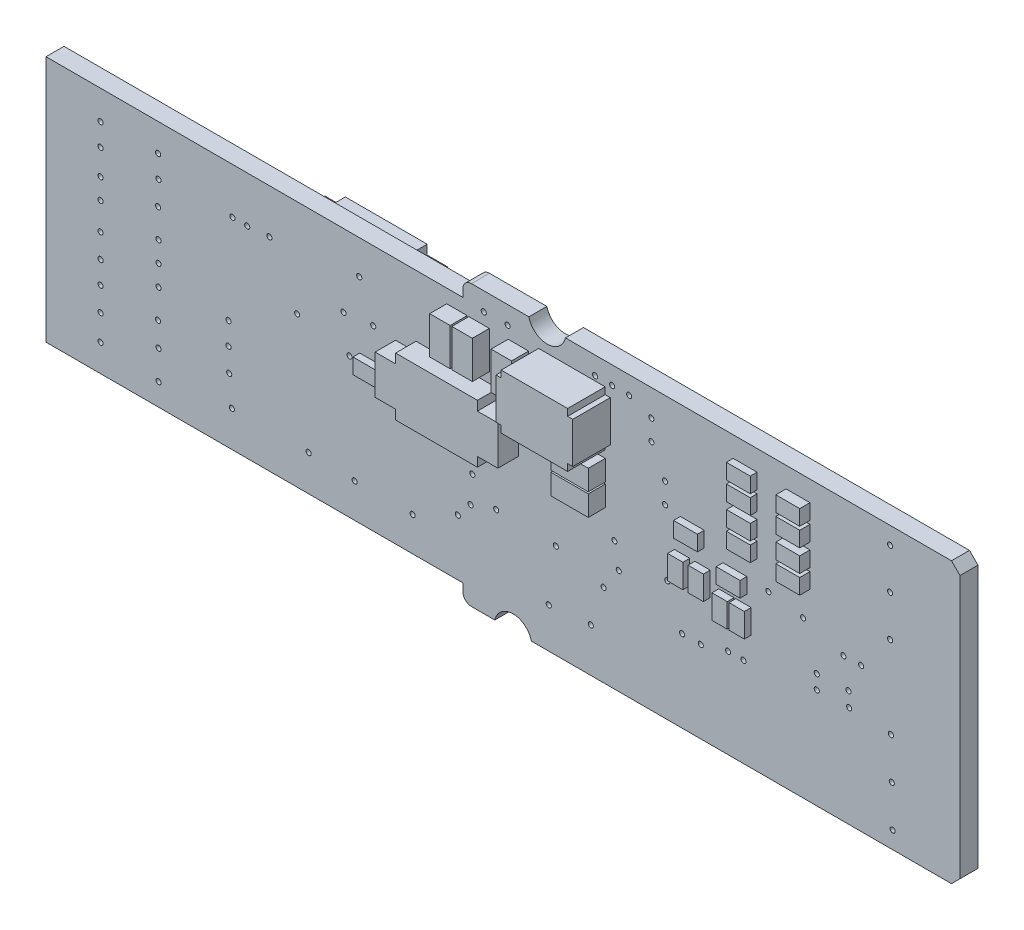
from build123d import *

# Parameters (mm, degrees)
BOARD_DEPTH         = 1.055
SKETCH2_R           = 0.15
PLATED_HOLES_DEPTH  = 56.792253271
SKETCH5_W           = 8.85
SKETCH5_H           = 4.1
R0203NAS_CE_1_DEPTH = 0.7
SKETCH6_W           = 8.85
SKETCH6_H           = 4.1
R0203NAS_CE_2_DEPTH = 0.7
SKETCH7_W           = 8.85
SKETCH7_H           = 4.1
R0203NAS_CE_3_DEPTH = 0.7
SKETCH8_W           = 1.4
SKETCH8_H           = 0.9
R0201NAS_1_DEPTH    = 0.4
SKETCH9_W           = 1.4
SKETCH9_H           = 0.9
R0201NAS_2_DEPTH    = 0.4
SKETCH10_W          = 1.4
SKETCH10_H          = 0.9
R0201NAS_3_DEPTH    = 0.4
SKETCH11_W          = 1.4
SKETCH11_H          = 0.9
R0201NAS_4_DEPTH    = 0.4
SKETCH12_W          = 1.4
SKETCH12_H          = 0.9
R0201NAS_5_DEPTH    = 0.4
SKETCH13_W          = 1.4
SKETCH13_H          = 0.9
R0201NAS_6_DEPTH    = 0.4
SKETCH14_W          = 1.4
SKETCH14_H          = 0.9
R0201NAS_7_DEPTH    = 0.4
SKETCH15_W          = 1.4
SKETCH15_H          = 0.9
R0201NAS_8_DEPTH    = 0.4
SKETCH16_W          = 1.4
SKETCH16_H          = 0.9
R0201NAS_9_DEPTH    = 0.4
SKETCH17_W          = 1.4
SKETCH17_H          = 0.9
R0201NAS_10_DEPTH   = 0.4
SKETCH18_W          = 1.4
SKETCH18_H          = 0.9
R0201NAS_11_DEPTH   = 0.4
SKETCH19_W          = 1.4
SKETCH19_H          = 0.9
R0201NAS_12_DEPTH   = 0.4
SKETCH20_W          = 0.9
SKETCH20_H          = 1.4
R0201NAS_13_DEPTH   = 0.4
SKETCH21_W          = 1.4
SKETCH21_H          = 0.9
R0201NAS_14_DEPTH   = 0.4
SKETCH22_W          = 1.4
SKETCH22_H          = 0.9
R0201NAS_15_DEPTH   = 0.4
SKETCH23_W          = 1.4
SKETCH23_H          = 0.9
R0201NAS_16_DEPTH   = 0.4
SKETCH24_W          = 1.4
SKETCH24_H          = 0.9
R0201NAS_17_DEPTH   = 0.4
SKETCH25_W          = 1.4
SKETCH25_H          = 0.9
R0201NAS_18_DEPTH   = 0.4
SKETCH26_W          = 1.4
SKETCH26_H          = 0.9
R0201NAS_19_DEPTH   = 0.4
SKETCH27_W          = 0.9
SKETCH27_H          = 1.4
R0201NAS_20_DEPTH   = 0.4
SKETCH28_W          = 0.9
SKETCH28_H          = 1.4
R0201NAS_21_DEPTH   = 0.4
SKETCH29_W          = 1.4
SKETCH29_H          = 0.9
R0201NAS_22_DEPTH   = 0.4
SKETCH30_W          = 1.4
SKETCH30_H          = 0.9
R0201NAS_23_DEPTH   = 0.4
SKETCH31_W          = 1.4
SKETCH31_H          = 0.9
R0201NAS_24_DEPTH   = 0.4
SKETCH32_W          = 0.9
SKETCH32_H          = 1.4
R0201NAS_25_DEPTH   = 0.4
SKETCH33_W          = 1.4
SKETCH33_H          = 0.9
R0201NAS_26_DEPTH   = 0.4
SKETCH34_W          = 0.9
SKETCH34_H          = 1.4
R0201NAS_27_DEPTH   = 0.4
SKETCH35_W          = 1.4
SKETCH35_H          = 0.9
R0201NAS_28_DEPTH   = 0.4
SKETCH36_W          = 0.9
SKETCH36_H          = 1.4
R0201NAS_29_DEPTH   = 0.4
SKETCH37_W          = 1.4
SKETCH37_H          = 0.9
R0201NAS_30_DEPTH   = 0.4
SKETCH38_W          = 1.4
SKETCH38_H          = 0.9
R0201NAS_31_DEPTH   = 0.4
SKETCH39_W          = 1.4
SKETCH39_H          = 0.9
R0201NAS_32_DEPTH   = 0.4
SKETCH40_W          = 1.4
SKETCH40_H          = 0.9
R0201NAS_33_DEPTH   = 0.4
SKETCH41_W          = 1.4
SKETCH41_H          = 0.9
R0201NAS_34_DEPTH   = 0.4
SKETCH42_W          = 1.4
SKETCH42_H          = 0.9
R0201NAS_35_DEPTH   = 0.4
SKETCH43_W          = 1.4
SKETCH43_H          = 0.9
R0201NAS_36_DEPTH   = 0.4
SKETCH44_W          = 1.4
SKETCH44_H          = 0.9
R0201NAS_37_DEPTH   = 0.4
SKETCH45_W          = 0.9
SKETCH45_H          = 1.4
R0201NAS_38_DEPTH   = 0.4
CE211NAS_1_DEPTH    = 2.2
SKETCH47_W          = 2.2
SKETCH47_H          = 1.2
C0204NAS_1_DEPTH    = 1
SKETCH48_W          = 2.2
SKETCH48_H          = 1.2
C0204NAS_2_DEPTH    = 1
SKETCH49_W          = 1.2
SKETCH49_H          = 2.2
C0204NAS_3_DEPTH    = 1
SKETCH50_W          = 2.2
SKETCH50_H          = 1.2
C0204NAS_4_DEPTH    = 1
SKETCH51_W          = 2.2
SKETCH51_H          = 1.2
C0204NAS_5_DEPTH    = 1
SKETCH52_W          = 1.2
SKETCH52_H          = 2.2
C0204NAS_6_DEPTH    = 1
SKETCH53_W          = 1.2
SKETCH53_H          = 2.2
C0204NAS_7_DEPTH    = 1
SKETCH54_W          = 2.2
SKETCH54_H          = 1.2
C0204NAS_8_DEPTH    = 1
SKETCH55_W          = 1.4
SKETCH55_H          = 0.9
C0215NAS_1_DEPTH    = 0.6
SKETCH56_W          = 1.4
SKETCH56_H          = 0.9
C0215NAS_2_DEPTH    = 0.6
SKETCH57_W          = 1.4
SKETCH57_H          = 0.9
C0215NAS_3_DEPTH    = 0.6
SKETCH58_W          = 1.4
SKETCH58_H          = 0.9
C0215NAS_4_DEPTH    = 0.6
SKETCH59_W          = 1.4
SKETCH59_H          = 0.9
C0215NAS_5_DEPTH    = 0.6
SKETCH60_W          = 1.4
SKETCH60_H          = 0.9
C0215NAS_6_DEPTH    = 0.6
SKETCH61_W          = 1.4
SKETCH61_H          = 0.9
C0215NAS_7_DEPTH    = 0.6
SKETCH62_W          = 1.4
SKETCH62_H          = 0.9
C0215NAS_8_DEPTH    = 0.6
Z0562NAS_1_DEPTH    = 1.2
Z0898NAS_1_DEPTH    = 1.2
Z0898NAS_2_DEPTH    = 1.2
Z0G58NAS_1_DEPTH    = 1.2


with BuildPart() as part:
    # Sketch1 → BOARD (new body)
    with BuildSketch(Plane.XY):
        with BuildLine():
            Line((24.45, 14.95), (24.45, 14.5))
            Line((24.45, 14.5), (2.3285, 14.5))
            Line((2.3285, 14.5), (0.2516, 14.5))
            Line((0.2516, 14.5), (0, 14.5))
            Line((0, 14.5), (0, 13.75))
            Line((0, 13.75), (0, 0.75))
            Line((0, 0.75), (0, 0))
            Line((0, 0), (0.2516, 0))
            Line((0.2516, 0), (2.3285, 0))
            Line((2.3285, 0), (24.45, 0))
            Line((24.45, 0), (24.45, -0.45))
            ThreePointArc((24.45, -0.45), (24.596455555, -0.803544445), (24.95, -0.95))
            Line((24.95, -0.95), (26.1285, -0.95))
            Line((26.1285, -0.95), (26.3188, -0.95))
            ThreePointArc((26.3188, -0.95), (27.39005, -0.099902191), (28.4613, -0.95))
            Line((28.4613, -0.95), (45.34, -0.95))
            Line((45.34, -0.95), (47.34, -0.95))
            Line((47.34, -0.95), (53.1, -0.95))
            Line((53.1, -0.95), (53.6, -0.45))
            Line((53.6, -0.45), (53.6, 14.95))
            Line((53.6, 14.95), (53.1, 15.45))
            Line((53.1, 15.45), (47.34, 15.45))
            Line((47.34, 15.45), (45.34, 15.45))
            Line((45.34, 15.45), (30.4613, 15.45))
            ThreePointArc((30.4613, 15.45), (29.39005, 14.599947896), (28.3188, 15.45))
            Line((28.3188, 15.45), (27.1285, 15.45))
            Line((27.1285, 15.45), (25.2516, 15.45))
            Line((25.2516, 15.45), (24.95, 15.45))
            ThreePointArc((24.95, 15.45), (24.596445331, 15.303554669), (24.45, 14.95))
        make_face()
    extrude(amount=BOARD_DEPTH)

    # Sketch2 → PLATED HOLES (cut, through all)
    with BuildSketch(Plane.XY):
        with Locations((38.4, 3.85)):
            Circle(SKETCH2_R)
        with Locations((37.3, 3.85)):
            Circle(SKETCH2_R)
        with Locations((10.7, 6.45)):
            Circle(SKETCH2_R)
        with Locations((10.9, 2.09)):
            Circle(SKETCH2_R)
        with Locations((10.7437, 3.79)):
            Circle(SKETCH2_R)
        with Locations((31.95, 1.62)):
            Circle(SKETCH2_R)
        with Locations((15.4, 2.1)):
            Circle(SKETCH2_R)
        with Locations((26.4, 4.7)):
            Circle(SKETCH2_R)
        with Locations((25, 7.25)):
            Circle(SKETCH2_R)
        with Locations((24.9, 4.2)):
            Circle(SKETCH2_R)
        with Locations((28.5234, 10.9401)):
            Circle(SKETCH2_R)
        with Locations((27.6985, 11.0002)):
            Circle(SKETCH2_R)
        with Locations((32.7, 3.9)):
            Circle(SKETCH2_R)
        with Locations((21.5, 2)):
            Circle(SKETCH2_R)
        with Locations((17.446, 10.2478)):
            Circle(SKETCH2_R)
        with Locations((13.1, 11.9)):
            Circle(SKETCH2_R)
        with Locations((24.33, 8.18)):
            Circle(SKETCH2_R)
        with Locations((24.15, 3.3)):
            Circle(SKETCH2_R)
        with Locations((6.573, 12.87)):
            Circle(SKETCH2_R)
        with Locations((47.8, 7.4841)):
            Circle(SKETCH2_R)
        with Locations((46.76, 7.46)):
            Circle(SKETCH2_R)
        with Locations((30.8, 7.6)):
            Circle(SKETCH2_R)
        with Locations((29.8, 7.6)):
            Circle(SKETCH2_R)
        with Locations((6.6, 11.57)):
            Circle(SKETCH2_R)
        with Locations((6.573, 10.17)):
            Circle(SKETCH2_R)
        with Locations((47.06, 5.83)):
            Circle(SKETCH2_R)
        with Locations((47.1, 4.99)):
            Circle(SKETCH2_R)
        with Locations((6.573, 4.4)):
            Circle(SKETCH2_R)
        with Locations((6.6, 3)):
            Circle(SKETCH2_R)
        with Locations((6.6, 1.3)):
            Circle(SKETCH2_R)
        with Locations((23, 12.127)):
            Circle(SKETCH2_R)
        with Locations((23, 11.3)):
            Circle(SKETCH2_R)
        with Locations((33.33, 6.5845)):
            Circle(SKETCH2_R)
        with Locations((23.25, 8.15)):
            Circle(SKETCH2_R)
        with Locations((35.5, 13.9)):
            Circle(SKETCH2_R)
        with Locations((35.5, 12.7)):
            Circle(SKETCH2_R)
        with Locations((36.3, 11.1)):
            Circle(SKETCH2_R)
        with Locations((36.3, 9.9)):
            Circle(SKETCH2_R)
        with Locations((23.15, 9.55)):
            Circle(SKETCH2_R)
        with Locations((33.59, 5.2)):
            Circle(SKETCH2_R)
        with Locations((36.4342, 6.1)):
            Circle(SKETCH2_R)
        with Locations((42.36, 8.5149)):
            Circle(SKETCH2_R)
        with Locations((44.4, 8.2)):
            Circle(SKETCH2_R)
        with Locations((40.9, 4.3)):
            Circle(SKETCH2_R)
        with Locations((40, 4.3)):
            Circle(SKETCH2_R)
        with Locations((6.6, 8.5)):
            Circle(SKETCH2_R)
        with Locations((45.2, 4.94)):
            Circle(SKETCH2_R)
        with Locations((45.2, 5.767)):
            Circle(SKETCH2_R)
        with Locations((25, 5.8)):
            Circle(SKETCH2_R)
        with Locations((6.6, 7.3)):
            Circle(SKETCH2_R)
        with Locations((6.6, 6.1)):
            Circle(SKETCH2_R)
        with Locations((3.2, 12.8)):
            Circle(SKETCH2_R)
        with Locations((10.7, 5.15)):
            Circle(SKETCH2_R)
        with Locations((29.9, 4.6)):
            Circle(SKETCH2_R)
        with Locations((14.725, 8.8)):
            Circle(SKETCH2_R)
        with Locations((18.1, 2)):
            Circle(SKETCH2_R)
        with Locations((17.8, 8.2)):
            Circle(SKETCH2_R)
        with Locations((49.65, 0.05)):
            Circle(SKETCH2_R)
        with Locations((49.6, 2.45)):
            Circle(SKETCH2_R)
        with Locations((49.5, 9.65)):
            Circle(SKETCH2_R)
        with Locations((49.5495, 4.8505)):
            Circle(SKETCH2_R)
        with Locations((49.5, 12.05)):
            Circle(SKETCH2_R)
        with Locations((25.67, 14.377)):
            Circle(SKETCH2_R)
        with Locations((27.07, 14.4)):
            Circle(SKETCH2_R)
        with Locations((32.5, 10.9)):
            Circle(SKETCH2_R)
        with Locations((32.2, 14.4)):
            Circle(SKETCH2_R)
        with Locations((33.2, 14.4)):
            Circle(SKETCH2_R)
        with Locations((34.2, 14.4)):
            Circle(SKETCH2_R)
        with Locations((49.5004, 14.4443)):
            Circle(SKETCH2_R)
        with Locations((18.37, 12.51)):
            Circle(SKETCH2_R)
        with Locations((19.19, 10.43)):
            Circle(SKETCH2_R)
        with Locations((29.485, 1.4)):
            Circle(SKETCH2_R)
        with Locations((11.8, 11.8)):
            Circle(SKETCH2_R)
        with Locations((10.9377, 11.8134)):
            Circle(SKETCH2_R)
        with Locations((3.2, 11.5)):
            Circle(SKETCH2_R)
        with Locations((3.2, 10)):
            Circle(SKETCH2_R)
        with Locations((3.2, 8.8)):
            Circle(SKETCH2_R)
        with Locations((3.2, 7.2)):
            Circle(SKETCH2_R)
        with Locations((3.2, 5.8)):
            Circle(SKETCH2_R)
        with Locations((3.2, 4.5)):
            Circle(SKETCH2_R)
        with Locations((3.2, 3.1)):
            Circle(SKETCH2_R)
        with Locations((3.2, 1.6)):
            Circle(SKETCH2_R)
    extrude(amount=PLATED_HOLES_DEPTH, mode=Mode.SUBTRACT)


with BuildPart() as body_2:
    # Sketch5 → R0203NAS_CE-1 (new body)
    with BuildSketch(Plane.XY):
        with Locations((4.9, 7.25)):
            Rectangle(SKETCH5_W, SKETCH5_H)
    extrude(amount=-R0203NAS_CE_1_DEPTH)


with BuildPart() as body_3:
    # Sketch6 → R0203NAS_CE-2 (new body)
    with BuildSketch(Plane.XY):
        with Locations((4.875, 11.45)):
            Rectangle(SKETCH6_W, SKETCH6_H)
    extrude(amount=-R0203NAS_CE_2_DEPTH)


with BuildPart() as body_4:
    # Sketch7 → R0203NAS_CE-3 (new body)
    with BuildSketch(Plane.XY):
        with Locations((4.875, 3.05)):
            Rectangle(SKETCH7_W, SKETCH7_H)
    extrude(amount=-R0203NAS_CE_3_DEPTH)


with BuildPart() as body_5:
    # Sketch8 → R0201NAS-1 (new body)
    with BuildSketch(Plane.XY.offset(1.055)):
        with Locations((41, 10.3)):
            Rectangle(SKETCH8_W, SKETCH8_H)
    extrude(amount=R0201NAS_1_DEPTH)


with BuildPart() as body_6:
    # Sketch9 → R0201NAS-2 (new body)
    with BuildSketch(Plane.XY):
        with Locations((22.7, 10.3)):
            Rectangle(SKETCH9_W, SKETCH9_H)
    extrude(amount=-R0201NAS_2_DEPTH)


with BuildPart() as body_7:
    # Sketch10 → R0201NAS-3 (new body)
    with BuildSketch(Plane.XY):
        with Locations((20.3, 9.4)):
            Rectangle(SKETCH10_W, SKETCH10_H)
    extrude(amount=-R0201NAS_3_DEPTH)


with BuildPart() as body_8:
    # Sketch11 → R0201NAS-4 (new body)
    with BuildSketch(Plane.XY):
        with Locations((11.88, 5.15)):
            Rectangle(SKETCH11_W, SKETCH11_H)
    extrude(amount=-R0201NAS_4_DEPTH)


with BuildPart() as body_9:
    # Sketch12 → R0201NAS-5 (new body)
    with BuildSketch(Plane.XY):
        with Locations((11.88, 9.35)):
            Rectangle(SKETCH12_W, SKETCH12_H)
    extrude(amount=-R0201NAS_5_DEPTH)


with BuildPart() as body_10:
    # Sketch13 → R0201NAS-6 (new body)
    with BuildSketch(Plane.XY):
        with Locations((11.88, 7.95)):
            Rectangle(SKETCH13_W, SKETCH13_H)
    extrude(amount=-R0201NAS_6_DEPTH)


with BuildPart() as body_11:
    # Sketch14 → R0201NAS-7 (new body)
    with BuildSketch(Plane.XY):
        with Locations((23.7, 5.8)):
            Rectangle(SKETCH14_W, SKETCH14_H)
    extrude(amount=-R0201NAS_7_DEPTH)


with BuildPart() as body_12:
    # Sketch15 → R0201NAS-8 (new body)
    with BuildSketch(Plane.XY):
        with Locations((23.7, 2.5)):
            Rectangle(SKETCH15_W, SKETCH15_H)
    extrude(amount=-R0201NAS_8_DEPTH)


with BuildPart() as body_13:
    # Sketch16 → R0201NAS-9 (new body)
    with BuildSketch(Plane.XY):
        with Locations((11.85, 3.79)):
            Rectangle(SKETCH16_W, SKETCH16_H)
    extrude(amount=-R0201NAS_9_DEPTH)


with BuildPart() as body_14:
    # Sketch17 → R0201NAS-10 (new body)
    with BuildSketch(Plane.XY):
        with Locations((11.88, 6.45)):
            Rectangle(SKETCH17_W, SKETCH17_H)
    extrude(amount=-R0201NAS_10_DEPTH)


with BuildPart() as body_15:
    # Sketch18 → R0201NAS-11 (new body)
    with BuildSketch(Plane.XY):
        with Locations((17.9, 9.4)):
            Rectangle(SKETCH18_W, SKETCH18_H)
    extrude(amount=-R0201NAS_11_DEPTH)


with BuildPart() as body_16:
    # Sketch19 → R0201NAS-12 (new body)
    with BuildSketch(Plane.XY.offset(1.055)):
        with Locations((19.1, 8.2)):
            Rectangle(SKETCH19_W, SKETCH19_H)
    extrude(amount=R0201NAS_12_DEPTH)


with BuildPart() as body_17:
    # Sketch20 → R0201NAS-13 (new body)
    with BuildSketch(Plane.XY):
        with Locations((25.9, 7.7)):
            Rectangle(SKETCH20_W, SKETCH20_H)
    extrude(amount=-R0201NAS_13_DEPTH)


with BuildPart() as body_18:
    # Sketch21 → R0201NAS-14 (new body)
    with BuildSketch(Plane.XY):
        with Locations((23.7, 7.3)):
            Rectangle(SKETCH21_W, SKETCH21_H)
    extrude(amount=-R0201NAS_14_DEPTH)


with BuildPart() as body_19:
    # Sketch22 → R0201NAS-15 (new body)
    with BuildSketch(Plane.XY):
        with Locations((23.7, 4.2)):
            Rectangle(SKETCH22_W, SKETCH22_H)
    extrude(amount=-R0201NAS_15_DEPTH)


with BuildPart() as body_20:
    # Sketch23 → R0201NAS-16 (new body)
    with BuildSketch(Plane.XY):
        with Locations((14.1, 2.1)):
            Rectangle(SKETCH23_W, SKETCH23_H)
    extrude(amount=-R0201NAS_16_DEPTH)


with BuildPart() as body_21:
    # Sketch24 → R0201NAS-17 (new body)
    with BuildSketch(Plane.XY):
        with Locations((12.15, 2.09)):
            Rectangle(SKETCH24_W, SKETCH24_H)
    extrude(amount=-R0201NAS_17_DEPTH)


with BuildPart() as body_22:
    # Sketch25 → R0201NAS-18 (new body)
    with BuildSketch(Plane.XY):
        with Locations((31.5, 3.9)):
            Rectangle(SKETCH25_W, SKETCH25_H)
    extrude(amount=-R0201NAS_18_DEPTH)


with BuildPart() as body_23:
    # Sketch26 → R0201NAS-19 (new body)
    with BuildSketch(Plane.XY):
        with Locations((31.5, 2.4)):
            Rectangle(SKETCH26_W, SKETCH26_H)
    extrude(amount=-R0201NAS_19_DEPTH)


with BuildPart() as body_24:
    # Sketch27 → R0201NAS-20 (new body)
    with BuildSketch(Plane.XY):
        with Locations((39.7, 10.5)):
            Rectangle(SKETCH27_W, SKETCH27_H)
    extrude(amount=-R0201NAS_20_DEPTH)


with BuildPart() as body_25:
    # Sketch28 → R0201NAS-21 (new body)
    with BuildSketch(Plane.XY):
        with Locations((39.7, 13.3)):
            Rectangle(SKETCH28_W, SKETCH28_H)
    extrude(amount=-R0201NAS_21_DEPTH)


with BuildPart() as body_26:
    # Sketch29 → R0201NAS-22 (new body)
    with BuildSketch(Plane.XY.offset(1.055)):
        with Locations((40.4, 8.2)):
            Rectangle(SKETCH29_W, SKETCH29_H)
    extrude(amount=R0201NAS_22_DEPTH)


with BuildPart() as body_27:
    # Sketch30 → R0201NAS-23 (new body)
    with BuildSketch(Plane.XY.offset(1.055)):
        with Locations((37.9, 9.3)):
            Rectangle(SKETCH30_W, SKETCH30_H)
    extrude(amount=R0201NAS_23_DEPTH)


with BuildPart() as body_28:
    # Sketch31 → R0201NAS-24 (new body)
    with BuildSketch(Plane.XY):
        with Locations((41.7, 13.8)):
            Rectangle(SKETCH31_W, SKETCH31_H)
    extrude(amount=-R0201NAS_24_DEPTH)


with BuildPart() as body_29:
    # Sketch32 → R0201NAS-25 (new body)
    with BuildSketch(Plane.XY.offset(1.055)):
        with Locations((40.9, 6.5)):
            Rectangle(SKETCH32_W, SKETCH32_H)
    extrude(amount=R0201NAS_25_DEPTH)


with BuildPart() as body_30:
    # Sketch33 → R0201NAS-26 (new body)
    with BuildSketch(Plane.XY.offset(1.055)):
        with Locations((41, 11.4)):
            Rectangle(SKETCH33_W, SKETCH33_H)
    extrude(amount=R0201NAS_26_DEPTH)


with BuildPart() as body_31:
    # Sketch34 → R0201NAS-27 (new body)
    with BuildSketch(Plane.XY.offset(1.055)):
        with Locations((39.9, 6.5)):
            Rectangle(SKETCH34_W, SKETCH34_H)
    extrude(amount=R0201NAS_27_DEPTH)


with BuildPart() as body_32:
    # Sketch35 → R0201NAS-28 (new body)
    with BuildSketch(Plane.XY.offset(1.055)):
        with Locations((41, 12.7)):
            Rectangle(SKETCH35_W, SKETCH35_H)
    extrude(amount=R0201NAS_28_DEPTH)


with BuildPart() as body_33:
    # Sketch36 → R0201NAS-29 (new body)
    with BuildSketch(Plane.XY.offset(1.055)):
        with Locations((38.5, 7.2)):
            Rectangle(SKETCH36_W, SKETCH36_H)
    extrude(amount=R0201NAS_29_DEPTH)


with BuildPart() as body_34:
    # Sketch37 → R0201NAS-30 (new body)
    with BuildSketch(Plane.XY.offset(1.055)):
        with Locations((41, 13.8)):
            Rectangle(SKETCH37_W, SKETCH37_H)
    extrude(amount=R0201NAS_30_DEPTH)


with BuildPart() as body_35:
    # Sketch38 → R0201NAS-31 (new body)
    with BuildSketch(Plane.XY):
        with Locations((38, 10)):
            Rectangle(SKETCH38_W, SKETCH38_H)
    extrude(amount=-R0201NAS_31_DEPTH)


with BuildPart() as body_36:
    # Sketch39 → R0201NAS-32 (new body)
    with BuildSketch(Plane.XY):
        with Locations((41.7, 9.9)):
            Rectangle(SKETCH39_W, SKETCH39_H)
    extrude(amount=-R0201NAS_32_DEPTH)


with BuildPart() as body_37:
    # Sketch40 → R0201NAS-33 (new body)
    with BuildSketch(Plane.XY):
        with Locations((38, 11)):
            Rectangle(SKETCH40_W, SKETCH40_H)
    extrude(amount=-R0201NAS_33_DEPTH)


with BuildPart() as body_38:
    # Sketch41 → R0201NAS-34 (new body)
    with BuildSketch(Plane.XY):
        with Locations((41.7, 11)):
            Rectangle(SKETCH41_W, SKETCH41_H)
    extrude(amount=-R0201NAS_34_DEPTH)


with BuildPart() as body_39:
    # Sketch42 → R0201NAS-35 (new body)
    with BuildSketch(Plane.XY):
        with Locations((38, 12.7)):
            Rectangle(SKETCH42_W, SKETCH42_H)
    extrude(amount=-R0201NAS_35_DEPTH)


with BuildPart() as body_40:
    # Sketch43 → R0201NAS-36 (new body)
    with BuildSketch(Plane.XY):
        with Locations((41.7, 12.7)):
            Rectangle(SKETCH43_W, SKETCH43_H)
    extrude(amount=-R0201NAS_36_DEPTH)


with BuildPart() as body_41:
    # Sketch44 → R0201NAS-37 (new body)
    with BuildSketch(Plane.XY):
        with Locations((38, 13.8)):
            Rectangle(SKETCH44_W, SKETCH44_H)
    extrude(amount=-R0201NAS_37_DEPTH)


with BuildPart() as body_42:
    # Sketch45 → R0201NAS-38 (new body)
    with BuildSketch(Plane.XY.offset(1.055)):
        with Locations((37.3, 7.2)):
            Rectangle(SKETCH45_W, SKETCH45_H)
    extrude(amount=R0201NAS_38_DEPTH)


with BuildPart() as body_43:
    # Sketch46 → CE211NAS-1 (new body)
    with BuildSketch(Plane.XY.offset(1.055)):
        Polygon((28.59, 13.73), (28.59, 11.33), (28.89, 11.33), (28.89, 10.93), (32.79, 10.93), (32.79, 11.33), (33.09, 11.33), (33.09, 13.73), (32.79, 13.73), (32.79, 14.13), (28.89, 14.13), (28.89, 13.73), align=None)
    extrude(amount=CE211NAS_1_DEPTH)


with BuildPart() as body_44:
    # Sketch47 → C0204NAS-1 (new body)
    with BuildSketch(Plane.XY):
        with Locations((28.2, 4.7)):
            Rectangle(SKETCH47_W, SKETCH47_H)
    extrude(amount=-C0204NAS_1_DEPTH)


with BuildPart() as body_45:
    # Sketch48 → C0204NAS-2 (new body)
    with BuildSketch(Plane.XY.offset(1.055)):
        with Locations((31.7, 8.6)):
            Rectangle(SKETCH48_W, SKETCH48_H)
    extrude(amount=C0204NAS_2_DEPTH)


with BuildPart() as body_46:
    # Sketch49 → C0204NAS-3 (new body)
    with BuildSketch(Plane.XY.offset(1.055)):
        with Locations((24.1, 12.6)):
            Rectangle(SKETCH49_W, SKETCH49_H)
    extrude(amount=C0204NAS_3_DEPTH)


with BuildPart() as body_47:
    # Sketch50 → C0204NAS-4 (new body)
    with BuildSketch(Plane.XY):
        with Locations((19.9, 2)):
            Rectangle(SKETCH50_W, SKETCH50_H)
    extrude(amount=-C0204NAS_4_DEPTH)


with BuildPart() as body_48:
    # Sketch51 → C0204NAS-5 (new body)
    with BuildSketch(Plane.XY):
        with Locations((12.4, 12.9)):
            Rectangle(SKETCH51_W, SKETCH51_H)
    extrude(amount=-C0204NAS_5_DEPTH)


with BuildPart() as body_49:
    # Sketch52 → C0204NAS-6 (new body)
    with BuildSketch(Plane.XY.offset(1.055)):
        with Locations((25.4, 12.6)):
            Rectangle(SKETCH52_W, SKETCH52_H)
    extrude(amount=C0204NAS_6_DEPTH)


with BuildPart() as body_50:
    # Sketch53 → C0204NAS-7 (new body)
    with BuildSketch(Plane.XY.offset(1.055)):
        with Locations((27.7, 12.6)):
            Rectangle(SKETCH53_W, SKETCH53_H)
    extrude(amount=C0204NAS_7_DEPTH)


with BuildPart() as body_51:
    # Sketch54 → C0204NAS-8 (new body)
    with BuildSketch(Plane.XY.offset(1.055)):
        with Locations((31.7, 9.9)):
            Rectangle(SKETCH54_W, SKETCH54_H)
    extrude(amount=C0204NAS_8_DEPTH)


with BuildPart() as body_52:
    # Sketch55 → C0215NAS-1 (new body)
    with BuildSketch(Plane.XY.offset(1.055)):
        with Locations((44.1, 13.8)):
            Rectangle(SKETCH55_W, SKETCH55_H)
    extrude(amount=C0215NAS_1_DEPTH)


with BuildPart() as body_53:
    # Sketch56 → C0215NAS-2 (new body)
    with BuildSketch(Plane.XY.offset(1.055)):
        with Locations((44.1, 12.7)):
            Rectangle(SKETCH56_W, SKETCH56_H)
    extrude(amount=C0215NAS_2_DEPTH)


with BuildPart() as body_54:
    # Sketch57 → C0215NAS-3 (new body)
    with BuildSketch(Plane.XY.offset(1.055)):
        with Locations((44.1, 11.4)):
            Rectangle(SKETCH57_W, SKETCH57_H)
    extrude(amount=C0215NAS_3_DEPTH)


with BuildPart() as body_55:
    # Sketch58 → C0215NAS-4 (new body)
    with BuildSketch(Plane.XY.offset(1.055)):
        with Locations((44.1, 10.3)):
            Rectangle(SKETCH58_W, SKETCH58_H)
    extrude(amount=C0215NAS_4_DEPTH)


with BuildPart() as body_56:
    # Sketch59 → C0215NAS-5 (new body)
    with BuildSketch(Plane.XY):
        with Locations((44.1, 9.9)):
            Rectangle(SKETCH59_W, SKETCH59_H)
    extrude(amount=-C0215NAS_5_DEPTH)


with BuildPart() as body_57:
    # Sketch60 → C0215NAS-6 (new body)
    with BuildSketch(Plane.XY):
        with Locations((44.1, 11)):
            Rectangle(SKETCH60_W, SKETCH60_H)
    extrude(amount=-C0215NAS_6_DEPTH)


with BuildPart() as body_58:
    # Sketch61 → C0215NAS-7 (new body)
    with BuildSketch(Plane.XY):
        with Locations((44.1, 12.7)):
            Rectangle(SKETCH61_W, SKETCH61_H)
    extrude(amount=-C0215NAS_7_DEPTH)


with BuildPart() as body_59:
    # Sketch62 → C0215NAS-8 (new body)
    with BuildSketch(Plane.XY):
        with Locations((44.1, 13.8)):
            Rectangle(SKETCH62_W, SKETCH62_H)
    extrude(amount=-C0215NAS_8_DEPTH)


with BuildPart() as body_60:
    # Sketch63 → Z0562NAS-1 (new body)
    with BuildSketch(Plane.XY):
        Polygon((27.15, 3.625), (27.675, 3.625), (27.675, 4), (29.325, 4), (29.325, 3.625), (29.85, 3.625), (29.85, 1.975), (29.325, 1.975), (29.325, 1.6), (27.675, 1.6), (27.675, 1.975), (27.15, 1.975), align=None)
    extrude(amount=-Z0562NAS_1_DEPTH)


with BuildPart() as body_61:
    # Sketch64 → Z0898NAS-1 (new body)
    with BuildSketch(Plane.XY.offset(1.055)):
        Polygon((20.5, 10.35), (21.7, 10.35), (21.7, 10.9), (26.5, 10.9), (26.5, 10.35), (27.7, 10.35), (27.7, 8.05), (26.5, 8.05), (26.5, 7.5), (21.7, 7.5), (21.7, 8.05), (20.5, 8.05), align=None)
    extrude(amount=Z0898NAS_1_DEPTH)


with BuildPart() as body_62:
    # Sketch65 → Z0898NAS-2 (new body)
    with BuildSketch(Plane.XY):
        Polygon((21.3, 13.35), (20.1, 13.35), (20.1, 13.9), (15.3, 13.9), (15.3, 13.35), (14.1, 13.35), (14.1, 11.05), (15.3, 11.05), (15.3, 10.5), (20.1, 10.5), (20.1, 11.05), (21.3, 11.05), align=None)
    extrude(amount=-Z0898NAS_2_DEPTH)


with BuildPart() as body_63:
    # Sketch66 → Z0G58NAS-1 (new body)
    with BuildSketch(Plane.XY):
        Polygon((20, 3), (15.2, 3), (15.2, 3.25), (14, 3.25), (14, 8.15), (15.2, 8.15), (15.2, 8.4), (20, 8.4), (20, 8.15), (21.2, 8.15), (21.2, 3.25), (20, 3.25), align=None)
    extrude(amount=-Z0G58NAS_1_DEPTH)


solid = Compound([part.part, body_2.part, body_3.part, body_4.part, body_5.part, body_6.part, body_7.part, body_8.part, body_9.part, body_10.part, body_11.part, body_12.part, body_13.part, body_14.part, body_15.part, body_16.part, body_17.part, body_18.part, body_19.part, body_20.part, body_21.part, body_22.part, body_23.part, body_24.part, body_25.part, body_26.part, body_27.part, body_28.part, body_29.part, body_30.part, body_31.part, body_32.part, body_33.part, body_34.part, body_35.part, body_36.part, body_37.part, body_38.part, body_39.part, body_40.part, body_41.part, body_42.part, body_43.part, body_44.part, body_45.part, body_46.part, body_47.part, body_48.part, body_49.part, body_50.part, body_51.part, body_52.part, body_53.part, body_54.part, body_55.part, body_56.part, body_57.part, body_58.part, body_59.part, body_60.part, body_61.part, body_62.part, body_63.part])
